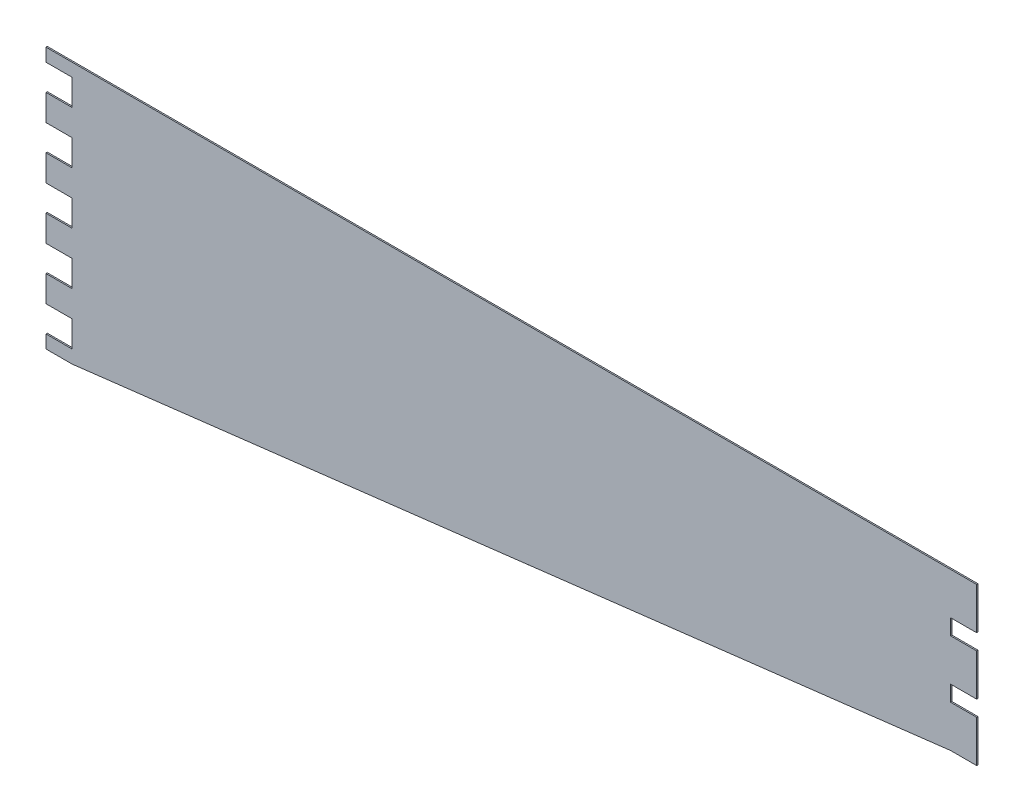
from build123d import *

# Parameters (mm, degrees)
BOSS_EXTRUDE1_DEPTH = 0.125
SKETCH3_W           = 5
SKETCH3_H           = 5
CUT_EXTRUDE1_DEPTH  = 185.889325003
LPATTERN2_COUNT     = 5
LPATTERN2_PITCH     = 10
SKETCH4_W           = 5
SKETCH4_H           = 3
CUT_EXTRUDE2_DEPTH  = 185.889325003
LPATTERN3_COUNT     = 2
LPATTERN3_PITCH     = 11


with BuildPart() as part:
    # Sketch2 → Boss-Extrude1 (new, symmetric)
    with BuildSketch(Plane.XY):
        Polygon((0, 0), (5, 0), (173, 20), (178, 20), (178, 50), (0, 50), align=None)
    extrude(amount=BOSS_EXTRUDE1_DEPTH, both=True)

    # Sketch3 → Cut-Extrude1 (cut, through all)
    with BuildSketch(Plane.XY.offset(0.125)):
        with Locations((2.5, 45)):
            Rectangle(SKETCH3_W, SKETCH3_H)
    cut_extrude1 = extrude(amount=-CUT_EXTRUDE1_DEPTH, mode=Mode.SUBTRACT)

    # LPattern2: Cut-Extrude1 ×5
    with Locations(*[(0, -i * LPATTERN2_PITCH, 0) for i in range(1, LPATTERN2_COUNT)]):
        add(cut_extrude1, mode=Mode.SUBTRACT)

    # Sketch4 → Cut-Extrude2 (cut, through all)
    with BuildSketch(Plane.XY.offset(0.125)):
        with Locations((175.5, 40.5)):
            Rectangle(SKETCH4_W, SKETCH4_H)
    cut_extrude2 = extrude(amount=-CUT_EXTRUDE2_DEPTH, mode=Mode.SUBTRACT)

    # LPattern3: Cut-Extrude2 ×2
    with Locations(*[(0, -i * LPATTERN3_PITCH, 0) for i in range(1, LPATTERN3_COUNT)]):
        add(cut_extrude2, mode=Mode.SUBTRACT)


solid = part.part
